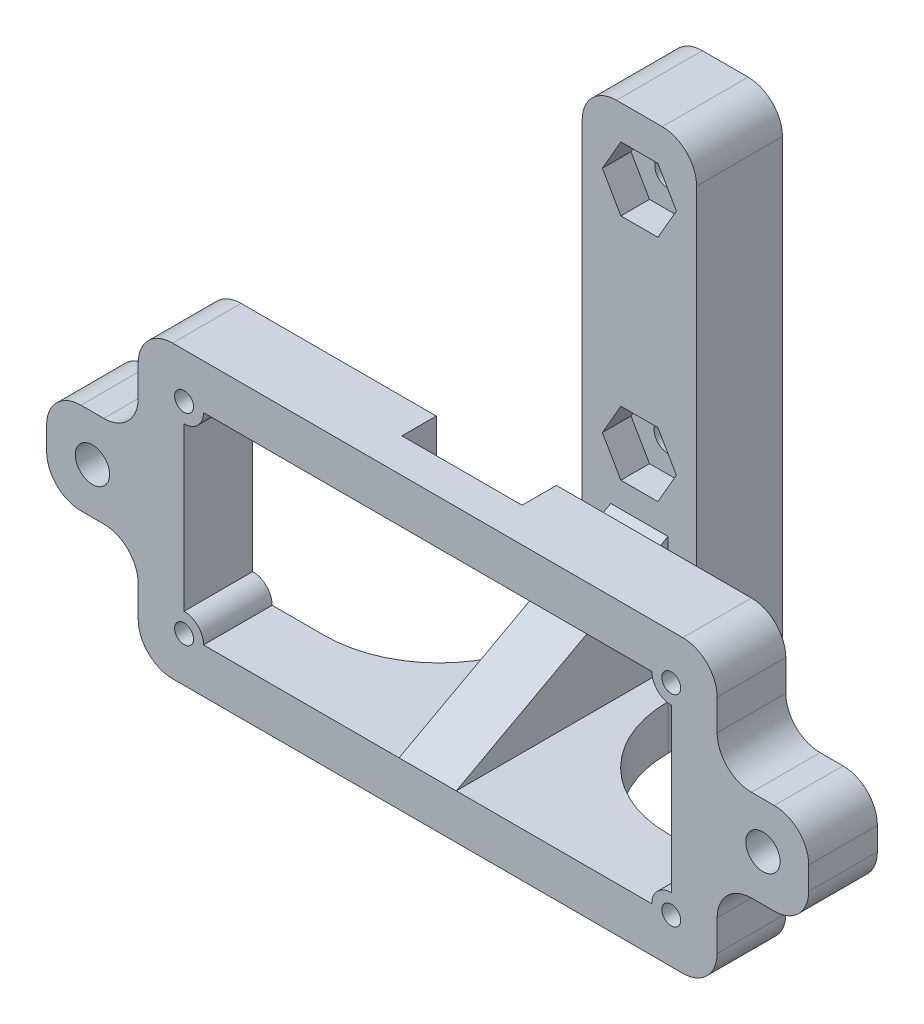
from build123d import *

# Parameters (mm, degrees)
ESQUISSE1_W             = 45.59
ESQUISSE1_H             = 20.4
ESQUISSE1_R             = 0.825
BOSS_EXTRU_1_DEPTH      = 6
ESQUISSE3_W             = 50.59
ESQUISSE3_H             = 25.4
ESQUISSE3_W_2           = 45.59
ESQUISSE3_H_2           = 20.4
BOSS_EXTRU_2_DEPTH      = 6
ENL_V_MAT_EXTRU_1_DEPTH = 6
ESQUISSE5_W             = 10
ESQUISSE5_H             = 3.91
BOSS_EXTRU_5_DEPTH      = 20
ESQUISSE7_W             = 10.5
ESQUISSE7_H             = 3
ENL_V_MAT_EXTRU_2_DEPTH = 5
CONG_2_R                = 3
ESQUISSE11_W            = 10
ESQUISSE11_H            = 44.672691235
ESQUISSE11_R            = 1.158112189
ESQUISSE11_R_2          = 1.218914383
BOSS_EXTRU_7_DEPTH      = 7.5
CONG_3_R                = 3
ENL_V_MAT_EXTRU_5_DEPTH = 2.5
ESQUISSE14_W            = 6
ESQUISSE14_H            = 8
BOSS_EXTRU_9_DEPTH      = 8
ESQUISSE15_W            = 6
ESQUISSE15_H            = 8
BOSS_EXTRU_10_DEPTH     = 8
ESQUISSE16_R            = 1.5
ENL_V_MAT_EXTRU_6_DEPTH = 6
ENL_V_START             = -3.5
ENL_V_MAT_EXTRU_7_DEPTH = 2.5
CONG_6_R                = 3
CONG_7_R                = 10
BOSS_EXTRU_11_START     = -2.5
BOSS_EXTRU_11_DEPTH     = 5


with BuildPart() as part:
    # Esquisse1 → Boss.-Extru.1 (new body)
    with BuildSketch(Plane.XY):
        Rectangle(ESQUISSE1_W, ESQUISSE1_H)
        with Locations((-21.285, 8.79)):
            Circle(ESQUISSE1_R, mode=Mode.SUBTRACT)
        with Locations((21.285, 8.79)):
            Circle(ESQUISSE1_R, mode=Mode.SUBTRACT)
        with Locations((21.285, -8.79)):
            Circle(ESQUISSE1_R, mode=Mode.SUBTRACT)
        with Locations((-21.285, -8.79)):
            Circle(ESQUISSE1_R, mode=Mode.SUBTRACT)
    extrude(amount=BOSS_EXTRU_1_DEPTH)

    # Esquisse3 → Boss.-Extru.2 (add)
    with BuildSketch(Plane.XY.offset(6)):
        Rectangle(ESQUISSE3_W, ESQUISSE3_H)
        Rectangle(ESQUISSE3_W_2, ESQUISSE3_H_2, mode=Mode.SUBTRACT)
    extrude(amount=-BOSS_EXTRU_2_DEPTH)

    # Esquisse4 → Enlèv. mat.-Extru.1 (cut)
    with BuildSketch(Plane.XY.offset(6)):
        with BuildLine():
            Line((19.585, -8.79), (-19.585, -8.79))
            ThreePointArc((-19.585, -8.79), (-20.082918472, -7.587918472), (-21.285, -7.09))
            Line((-21.285, -7.09), (-21.285, 7.09))
            ThreePointArc((-21.285, 7.09), (-20.082918472, 7.587918472), (-19.585, 8.79))
            Line((-19.585, 8.79), (19.585, 8.79))
            ThreePointArc((19.585, 8.79), (20.082918472, 7.587918472), (21.285, 7.09))
            Line((21.285, 7.09), (21.285, -7.09))
            ThreePointArc((21.285, -7.09), (20.082918472, -7.587918472), (19.585, -8.79))
        make_face()
    extrude(amount=-ENL_V_MAT_EXTRU_1_DEPTH, mode=Mode.SUBTRACT)

    # Esquisse5 → Boss.-Extru.5 (add)
    with BuildSketch(Plane(origin=(0, 0, 0), x_dir=(-1, 0, 0), z_dir=(0, 0, -1))):
        with Locations((0, -10.745)):
            Rectangle(ESQUISSE5_W, ESQUISSE5_H)
    extrude(amount=BOSS_EXTRU_5_DEPTH)

    # Esquisse7 → Enlèv. mat.-Extru.2 (cut)
    with BuildSketch(Plane(origin=(0, 12.7, 0), x_dir=(1, 0, 0), z_dir=(0, 1, 0))):
        with Locations((0, -1.5)):
            Rectangle(ESQUISSE7_W, ESQUISSE7_H)
    extrude(amount=-ENL_V_MAT_EXTRU_2_DEPTH, mode=Mode.SUBTRACT)

    # Congé2
    cong_2_edges = [part.edges().sort_by_distance(p)[0] for p in [
        (25.295, -12.7, 3),
        (25.295, 12.7, 3),
        (-25.295, 12.7, 3),
        (-25.295, -12.7, 3),
    ]]
    fillet(cong_2_edges, radius=CONG_2_R)

    # Esquisse11 → Boss.-Extru.7 (add)
    with BuildSketch(Plane(origin=(0, 0, -20), x_dir=(-1, 0, 0), z_dir=(0, 0, -1))):
        with Locations((0, 9.636345618)):
            Rectangle(ESQUISSE11_W, ESQUISSE11_H)
        with Locations((0, 26.21)):
            Circle(ESQUISSE11_R, mode=Mode.SUBTRACT)
        with Locations((0, 6.21)):
            Circle(ESQUISSE11_R_2, mode=Mode.SUBTRACT)
    extrude(amount=-BOSS_EXTRU_7_DEPTH)

    # Congé3
    cong_3_edges = [part.edges().sort_by_distance(p)[0] for p in [
        (5, 31.972691235, -16.25),
        (-5, 31.972691235, -16.25),
    ]]
    fillet(cong_3_edges, radius=CONG_3_R)

    # Esquisse12 → Enlèv. mat.-Extru.5 (cut)
    with BuildSketch(Plane.XY.offset(-12.5)):
        Polygon((1.616580754, 29.01), (-1.616580754, 29.01), (-3.233161507, 26.21), (-1.616580754, 23.41), (1.616580754, 23.41), (3.233161507, 26.21), align=None)
        Polygon((-1.616580754, 9.01), (-3.233161507, 6.21), (-1.616580754, 3.41), (1.616580754, 3.41), (3.233161507, 6.21), (1.616580754, 9.01), align=None)
    extrude(amount=-ENL_V_MAT_EXTRU_5_DEPTH, mode=Mode.SUBTRACT)

    # Esquisse14 → Boss.-Extru.9 (add)
    with BuildSketch(Plane.ZY.offset(25.295)):
        with Locations((3, 0)):
            Rectangle(ESQUISSE14_W, ESQUISSE14_H)
    extrude(amount=BOSS_EXTRU_9_DEPTH)

    # Esquisse15 → Boss.-Extru.10 (add)
    with BuildSketch(Plane(origin=(25.295, 0, 0), x_dir=(0, 0, -1), z_dir=(1, 0, 0))):
        with Locations((-3, 0)):
            Rectangle(ESQUISSE15_W, ESQUISSE15_H)
    extrude(amount=BOSS_EXTRU_10_DEPTH)

    # Esquisse16 → Enlèv. mat.-Extru.6 (cut)
    with BuildSketch(Plane.XY.offset(6)):
        with Locations((-29.295, 0)):
            Circle(ESQUISSE16_R)
        with Locations((29.295, 0)):
            Circle(ESQUISSE16_R)
    extrude(amount=-ENL_V_MAT_EXTRU_6_DEPTH, mode=Mode.SUBTRACT)

    # Esquisse17 → Enlèv. mat.-Extru.7 (cut)
    with BuildSketch(Plane.XY.offset(6).offset(ENL_V_START)):
        Polygon((-26.061838493, 0), (-27.678419246, 2.8), (-30.911580754, 2.8), (-32.528161507, 0), (-30.911580754, -2.8), (-27.678419246, -2.8), align=None)
        Polygon((32.528161507, 0), (30.911580754, 2.8), (27.678419246, 2.8), (26.061838493, 0), (27.678419246, -2.8), (30.911580754, -2.8), align=None)
    extrude(amount=-ENL_V_MAT_EXTRU_7_DEPTH, mode=Mode.SUBTRACT)

    # Congé6
    cong_6_edges = [part.edges().sort_by_distance(p)[0] for p in [
        (-25.295, -4, 3),
        (-33.295, -4, 3),
        (-33.295, 4, 3),
        (-25.295, 4, 3),
        (25.295, 4, 3),
        (33.295, 4, 3),
        (33.295, -4, 3),
        (25.295, -4, 3),
    ]]
    fillet(cong_6_edges, radius=CONG_6_R)

    # Congé7
    cong_7_edges = [part.edges().sort_by_distance(p)[0] for p in [
        (-5, -10.745, 0),
        (5, -10.745, 0),
    ]]
    fillet(cong_7_edges, radius=CONG_7_R)

    # Esquisse18 → Boss.-Extru.11 (add)
    with BuildSketch(Plane(origin=(5, 0, 0), x_dir=(0, 0, -1), z_dir=(1, 0, 0)).offset(BOSS_EXTRU_11_START)):
        Polygon((-6, -8.79), (12.5, 1.21), (12.5, -8.79), align=None)
    extrude(amount=-BOSS_EXTRU_11_DEPTH)


solid = part.part
